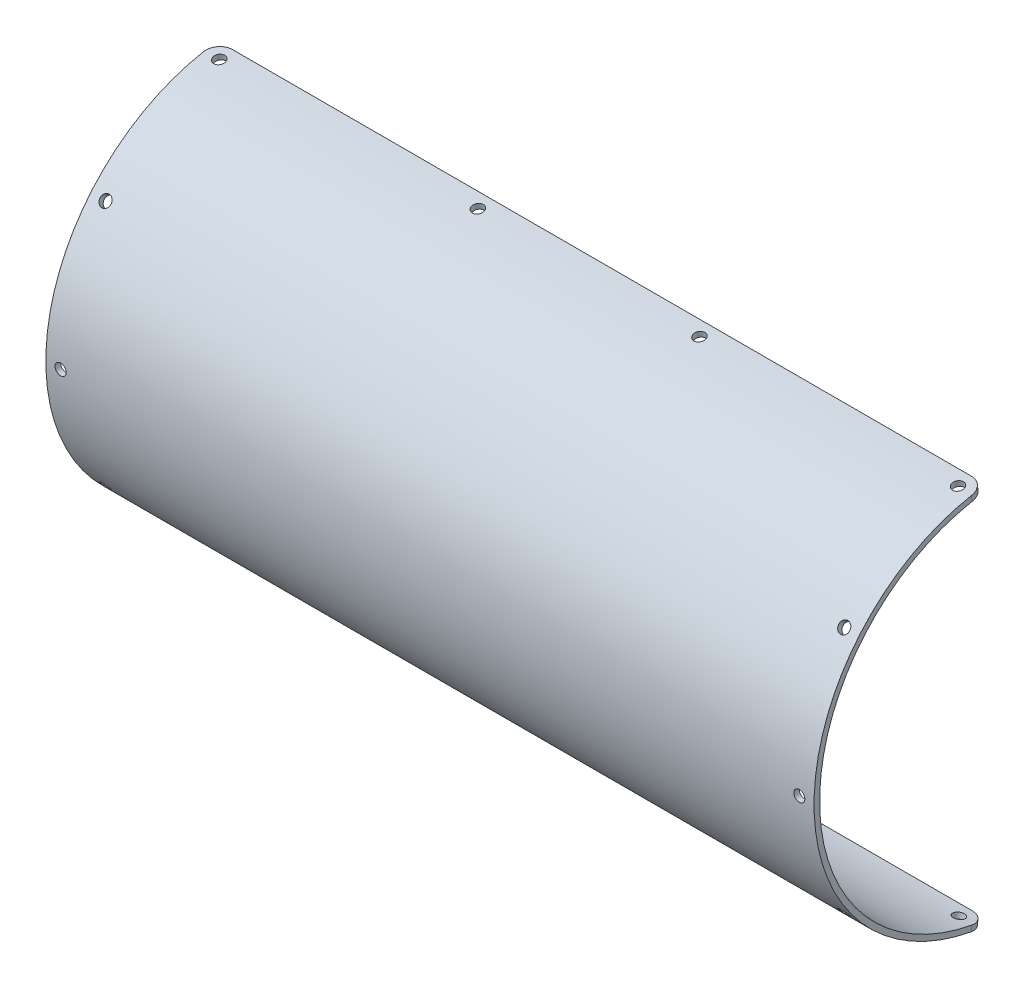
from build123d import *

# Parameters (mm, degrees)
BOSS_EXTRUDE1_DEPTH   = 208
FILLET1_R             = 4
CIRPATTERN1_COUNT     = 3
CIRPATTERN1_ANGLE     = 80
CIRPATTERN2_COUNT     = 3
CIRPATTERN2_ANGLE     = 80
LPATTERN1_START       = -52.000000081
LPATTERN1_OUTLINE_R   = 1.5
LPATTERN1_DEPTH       = 1.522282325
LPATTERN1_START_2     = 50.477717756
LPATTERN1_2_OUTLINE_R = 1.5
LPATTERN1_2_DEPTH     = 1.522282325


# Read off the part's stored shape, not the designer's step: LPattern1
with BuildPart() as part:
    # Sketch1 → Boss-Extrude1 (new body)
    with BuildSketch(Plane(origin=(0, 0, 0), x_dir=(0, 0, -1), z_dir=(1, 0, 0))):
        with BuildLine():
            Line((-5.43548009, -51.715138559), (-5.278687395, -50.223355716))
            ThreePointArc((-5.278687395, -50.223355716), (-50.5, 0), (-5.278687395, 50.223355716))
            Line((-5.278687395, 50.223355716), (-5.43548009, 51.715138559))
            ThreePointArc((-5.43548009, 51.715138559), (-52, 0), (-5.43548009, -51.715138559))
        make_face()
    extrude(amount=BOSS_EXTRUDE1_DEPTH)

    # Fillet1
    fillet1_edges = [part.edges().sort_by_distance(p)[0] for p in [
        (208, -50.969247138, 5.357083742),
        (208, 50.969247138, 5.357083742),
        (0, -50.969247138, 5.357083742),
        (0, 50.969247138, 5.357083742),
    ]]
    fillet(fillet1_edges, radius=FILLET1_R)

    # Sketch5 → Ø3.0mm Dowel Hole1 (revolve, cut)
    with BuildSketch(Plane(origin=(4, 0, 52), x_dir=(0, -1, 0), z_dir=(1, 0, 0))):
        Polygon((0, 0), (0, 18.191290929), (1.5, 17.29), (1.5, 0), align=None)
    f_3_0mm_dowel_hole1 = revolve(axis=Axis((4, 0, 58.35), (0, 0, -1)), mode=Mode.SUBTRACT)

    # CirPattern1: Ø3.0mm Dowel Hole1 ×3 about axis
    cirpattern1_axis = Axis((0, 0, 0), (1, 0, 0))
    for i in range(1, CIRPATTERN1_COUNT):
        add(f_3_0mm_dowel_hole1.rotate(cirpattern1_axis, i * CIRPATTERN1_ANGLE / (CIRPATTERN1_COUNT - 1)), mode=Mode.SUBTRACT)

    # CirPattern2: Ø3.0mm Dowel Hole1 ×3 about axis
    cirpattern2_axis = Axis((0, 0, 0), (-1, 0, 0))
    for i in range(1, CIRPATTERN2_COUNT):
        add(f_3_0mm_dowel_hole1.rotate(cirpattern2_axis, i * CIRPATTERN2_ANGLE / (CIRPATTERN2_COUNT - 1)), mode=Mode.SUBTRACT)

    # LPattern1 outline → LPattern1 (cut)
    with BuildSketch(Plane(origin=(0, 0, 0), x_dir=(1, 0, 0), z_dir=(0, 0.9848077530122088, -0.17364817766692697)).offset(LPATTERN1_START)):
        with Locations((74, 0)):
            Circle(LPATTERN1_OUTLINE_R)
    lpattern1 = extrude(amount=LPATTERN1_DEPTH, mode=Mode.SUBTRACT)

    # LPattern1 2 outline → LPattern1 2 (cut)
    with BuildSketch(Plane(origin=(0, 0, 0), x_dir=(1, 0, 0), z_dir=(0, 0.9848077530122088, 0.17364817766692697)).offset(LPATTERN1_START_2)):
        with Locations((74, 0)):
            Circle(LPATTERN1_2_OUTLINE_R)
    lpattern1_2 = extrude(amount=LPATTERN1_2_DEPTH, mode=Mode.SUBTRACT)

    # Mirror2: Ø3.0mm Dowel Hole1, LPattern1, LPattern1 2 across plane
    add(f_3_0mm_dowel_hole1.mirror(Plane(origin=(104, 0, 0), x_dir=(0, 0, 1), z_dir=(1, 0, 0))), mode=Mode.SUBTRACT)
    add(lpattern1.mirror(Plane(origin=(104, 0, 0), x_dir=(0, 0, 1), z_dir=(1, 0, 0))), mode=Mode.SUBTRACT)
    add(lpattern1_2.mirror(Plane(origin=(104, 0, 0), x_dir=(0, 0, 1), z_dir=(1, 0, 0))), mode=Mode.SUBTRACT)

    # Mirror2 copy 1 sketch → Mirror2 copy 1 (revolve, cut)
    with BuildSketch(Plane(origin=(204, -33.424955704, 39.834311042), x_dir=(0, -0.766044443118977, -0.6427876096865406), z_dir=(-1, 0, 0))):
        Polygon((0, 0), (0, -18.191290929), (1.5, -17.29), (1.5, 0), align=None)
    revolve(axis=Axis((204, -37.506657025, 44.698693256), (0, -0.6427876096865406, 0.766044443118977)), mode=Mode.SUBTRACT)

    # Mirror2 copy 2 sketch → Mirror2 copy 2 (revolve, cut)
    with BuildSketch(Plane(origin=(204, -51.210003157, 9.029705239), x_dir=(0, -0.17364817766692714, -0.9848077530122086), z_dir=(-1, 0, 0))):
        Polygon((0, 0), (0, -18.191290929), (1.5, -17.29), (1.5, 0), align=None)
    revolve(axis=Axis((204, -57.463532388, 10.132371167), (0, -0.9848077530122086, 0.17364817766692714)), mode=Mode.SUBTRACT)

    # Mirror2 copy 3 sketch → Mirror2 copy 3 (revolve, cut)
    with BuildSketch(Plane(origin=(204, 33.424955704, 39.834311042), x_dir=(0, -0.766044443118977, 0.6427876096865406), z_dir=(-1, 0, 0))):
        Polygon((0, 0), (0, -18.191290929), (1.5, -17.29), (1.5, 0), align=None)
    revolve(axis=Axis((204, 37.506657025, 44.698693256), (0, 0.6427876096865406, 0.766044443118977)), mode=Mode.SUBTRACT)

    # Mirror2 copy 4 sketch → Mirror2 copy 4 (revolve, cut)
    with BuildSketch(Plane(origin=(204, 51.210003157, 9.029705239), x_dir=(0, -0.17364817766692714, 0.9848077530122086), z_dir=(-1, 0, 0))):
        Polygon((0, 0), (0, -18.191290929), (1.5, -17.29), (1.5, 0), align=None)
    revolve(axis=Axis((204, 57.463532388, 10.132371167), (0, 0.9848077530122086, 0.17364817766692714)), mode=Mode.SUBTRACT)


solid = part.part
